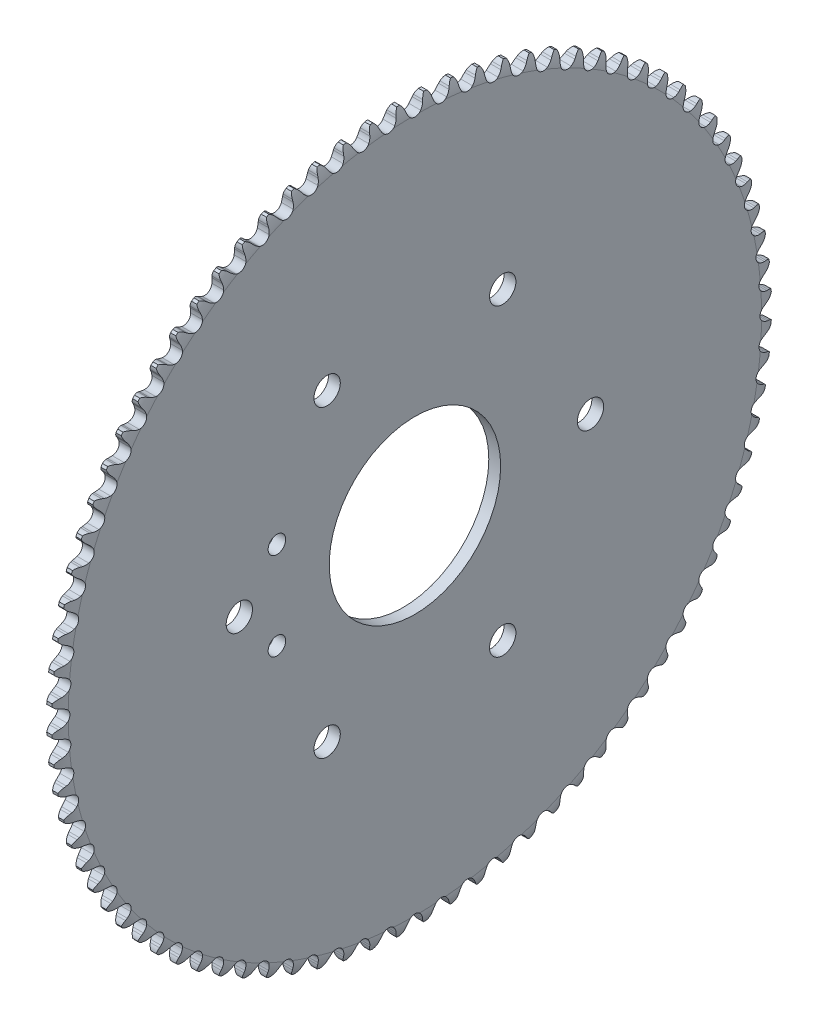
from build123d import *

# Parameters (mm, degrees)
CUT_EXTRUDE1_DEPTH = 185.09287215
CIRPATTERN1_COUNT  = 84
SKETCH3_R          = 4.7625
SKETCH3_R_2        = 3.175
SKETCH3_R_3        = 31.000000024
CUT_EXTRUDE2_DEPTH = 184.990499777


with BuildPart() as part:
    # Sketch1 → Revolve1 (revolve)
    with BuildSketch(Plane.XY):
        with BuildLine():
            Line((-50.8, 0), (-50.8, 125.362792215))
            ThreePointArc((-50.8, 125.362792215), (-50.497026992, 127.823873963), (-49.6062, 130.137992215))
            Line((-49.6062, 130.137992215), (-47.705264, 130.137992215))
            ThreePointArc((-47.705264, 130.137992215), (-46.814437008, 127.823873963), (-46.511464, 125.362792215))
            Line((-46.511464, 125.362792215), (-46.511464, 0))
            Line((-46.511464, 0), (-50.8, 0))
        make_face()
    revolve(axis=Axis((-50.8, 0, 0), (1, 0, 0)))

    # Sketch2 → Cut-Extrude1 (cut, through all)
    with BuildSketch(Plane(origin=(-46.511464, 0, 0), x_dir=(0, 0, -1), z_dir=(1, 0, 0))):
        with BuildLine():
            Line((3.015562003, 127.64341357), (3.260871519, 128.381660508))
            ThreePointArc((3.260871519, 128.381660508), (4.735686528, 130.390427398), (7.107026612, 131.156567027))
            ThreePointArc((7.107026612, 131.156567027), (0, 131.348981349), (-7.107026612, 131.156567027))
            ThreePointArc((-7.107026612, 131.156567027), (-4.735686528, 130.390427398), (-3.260871519, 128.381660508))
            Line((-3.260871519, 128.381660508), (-3.015562003, 127.64341357))
            ThreePointArc((-3.015562003, 127.64341357), (-2.627241154, 126.715752452), (-2.103568985, 125.857198033))
            ThreePointArc((-2.103568985, 125.857198033), (0, 124.778761139), (2.103568985, 125.857198033))
            ThreePointArc((2.103568985, 125.857198033), (2.627241154, 126.715752452), (3.015562003, 127.64341357))
        make_face()
    cut_extrude1 = extrude(amount=-CUT_EXTRUDE1_DEPTH, mode=Mode.SUBTRACT)

    # CirPattern1: Cut-Extrude1 ×84 about axis
    cirpattern1_axis = Axis((-46.511464, 0, 0), (-1, 0, 0))
    for i in range(1, CIRPATTERN1_COUNT):
        add(cut_extrude1.rotate(cirpattern1_axis, i * 360 / CIRPATTERN1_COUNT), mode=Mode.SUBTRACT)

    # Sketch3 → Cut-Extrude2 (cut, through all)
    with BuildSketch(Plane(origin=(-46.511464, 0, 0), x_dir=(0, 0, -1), z_dir=(1, 0, 0))):
        with Locations((-63.5, 0)):
            Circle(SKETCH3_R)
        with Locations((-49.911, 15.875)):
            Circle(SKETCH3_R_2)
        with Locations((-49.911, -15.875)):
            Circle(SKETCH3_R_2)
        Circle(SKETCH3_R_3)
        with Locations((-31.75, 54.99261314)):
            Circle(SKETCH3_R)
        with Locations((31.75, 54.99261314)):
            Circle(SKETCH3_R)
        with Locations((63.5, 0)):
            Circle(SKETCH3_R)
        with Locations((31.75, -54.99261314)):
            Circle(SKETCH3_R)
        with Locations((-31.75, -54.99261314)):
            Circle(SKETCH3_R)
    extrude(amount=-CUT_EXTRUDE2_DEPTH, mode=Mode.SUBTRACT)


solid = part.part
